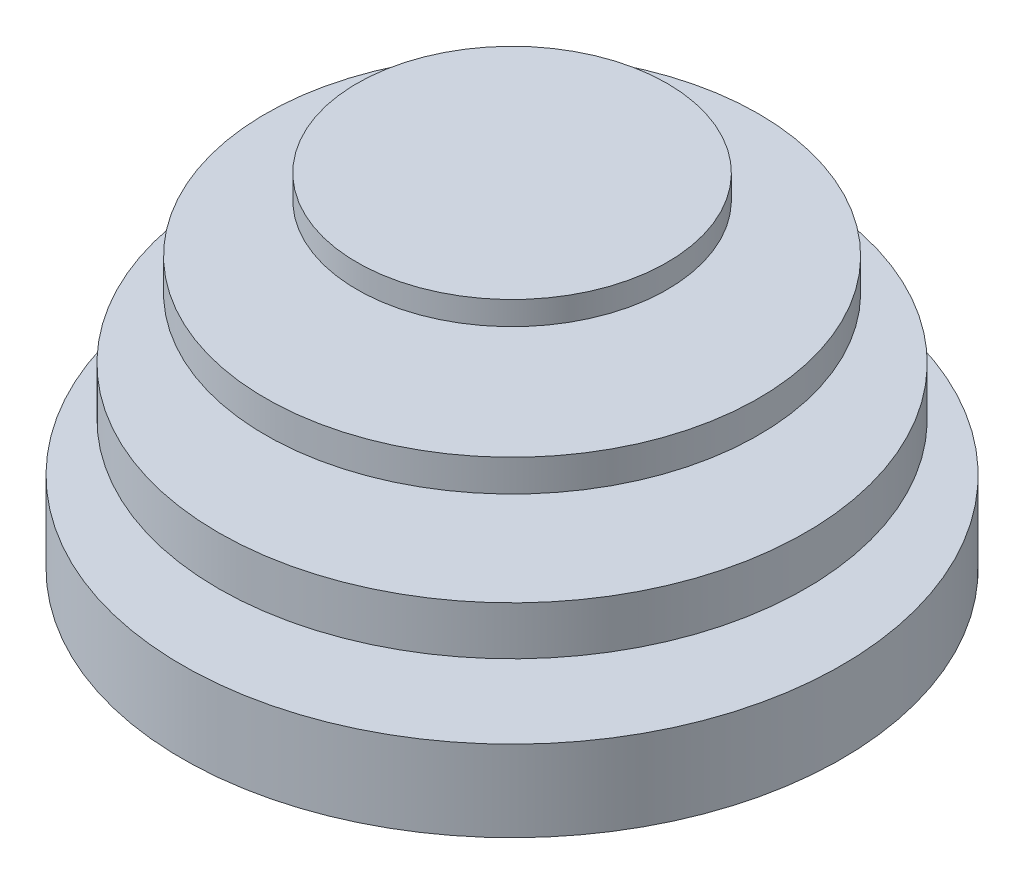
from build123d import *

# Parameters (mm, degrees)
SKETCH1_W              = 64.498680347
SKETCH1_H              = 15.853667228
SKETCH1_W_2            = 57.452606024
SKETCH1_H_2            = 9.485100051
SKETCH1_W_3            = 48.238508831
SKETCH1_H_3            = 6.233065748
SKETCH1_W_4            = 30.352320163
SKETCH1_H_4            = 4.607048596
CUT_EXTRUDE1_START     = -41.734440225
CUT_EXTRUDE1_OUTLINE_R = 21.904394949
CUT_EXTRUDE1_DEPTH     = 9.485100051


# Read off the part's stored shape, not the designer's step: Cut-Extrude1
with BuildPart() as part:
    # Sketch1 → Revolve1 (revolve)
    with BuildSketch(Plane.XY, mode=Mode.PRIVATE) as revolve1_sk:
        with Locations((32.249340174, 7.926833614)):
            Rectangle(SKETCH1_W, SKETCH1_H)
        with Locations((28.726303012, 30.081317305)):
            Rectangle(SKETCH1_W_2, SKETCH1_H_2)
        with Locations((24.119254416, 49.864525983)):
            Rectangle(SKETCH1_W_3, SKETCH1_H_3)
        with Locations((15.176160082, 64.769683206)):
            Rectangle(SKETCH1_W_4, SKETCH1_H_4)
    revolve(revolve1_sk.sketch.rotate(Axis((0, 25.338767279, 0), (0, 1, 0)), 90), axis=Axis((0, 25.338767279, 0), (0, 1, 0)))

    # Cut-Extrude1 outline → Cut-Extrude1 (cut)
    with BuildSketch(Plane(origin=(0, 67.073207504, 0), x_dir=(1, 0, 0), z_dir=(0, 1, 0)).offset(CUT_EXTRUDE1_START)):
        Circle(CUT_EXTRUDE1_OUTLINE_R)
    extrude(amount=CUT_EXTRUDE1_DEPTH, mode=Mode.SUBTRACT)


solid = part.part
